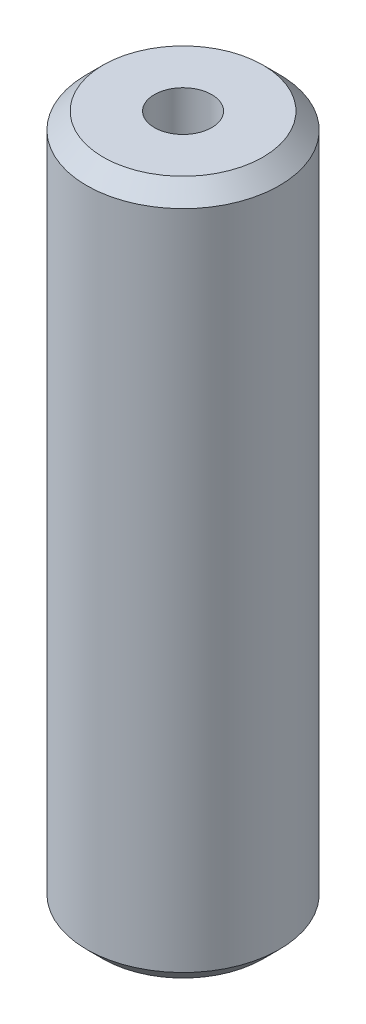
from build123d import *

# Parameters (mm, degrees)
SKETCH1_R           = 17.5
BOSS_EXTRUDE1_DEPTH = 126.19489596
SKETCH2_R           = 5.209023461
CUT_EXTRUDE1_DEPTH  = 129.598801575
CHAMFER1_SIZE       = 2.986106754


with BuildPart() as part:
    # Sketch1 → Boss-Extrude1 (new body)
    with BuildSketch(Plane(origin=(0, 0, 0), x_dir=(1, 0, 0), z_dir=(0, 1, 0))):
        Circle(SKETCH1_R)
    extrude(amount=BOSS_EXTRUDE1_DEPTH)

    # Sketch2 → Cut-Extrude1 (cut, through all)
    with BuildSketch(Plane(origin=(0, 0, 0), x_dir=(1, 0, 0), z_dir=(0, 1, 0))):
        Circle(SKETCH2_R)
    extrude(amount=CUT_EXTRUDE1_DEPTH, mode=Mode.SUBTRACT)

    # Chamfer1
    chamfer1_edges = [part.edges().sort_by_distance(p)[0] for p in [
        (-17.5, 126.19489596, 0),
        (-17.5, 0, 0),
    ]]
    chamfer(chamfer1_edges, length=CHAMFER1_SIZE)


solid = part.part
